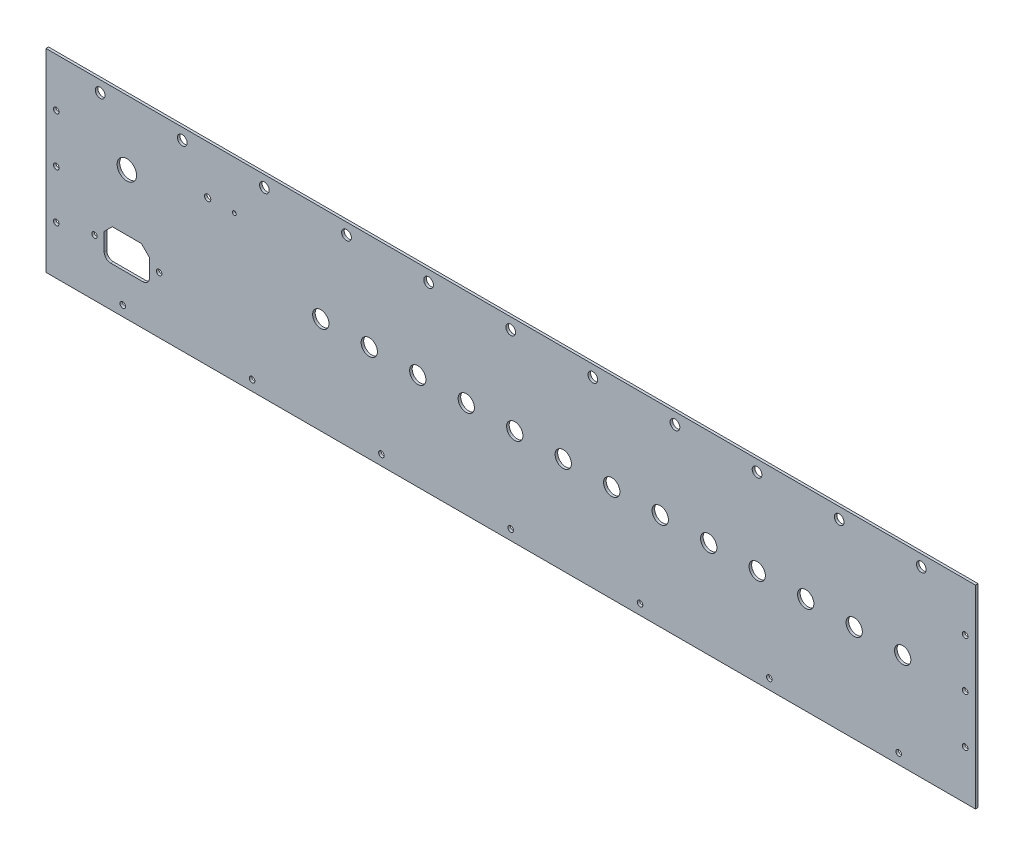
from build123d import *

# Parameters (mm, degrees)
SKETCH1_W               = 575
SKETCH1_H               = 120
BOSS_EXTRUDE1_DEPTH     = 1.5875
M3_CLEARANCE_HOLE1_D    = 3.4
F_3_8_CLEARANCE_HOLE1_D = 10.0838
LPATTERN1_COUNT         = 13
LPATTERN1_PITCH         = 30
CUT_EXTRUDE1_REACH      = 295.698
SKETCH8_R               = 1.95
SKETCH8_R_2             = 1.2
CUT_EXTRUDE2_REACH      = 295.698
SKETCH9_W               = 28
SKETCH9_H               = 20
FILLET1_R               = 4
CHAMFER1_SIZE           = 5
CUT_EXTRUDE3_REACH      = 295.698
SKETCH10_R              = 6
CUT_EXTRUDE4_REACH      = 295.698
SKETCH11_R              = 3
LPATTERN2_COUNT         = 11
LPATTERN2_PITCH         = 50.8
F_5_CLEARANCE_HOLE1_D   = 3.4544
F_5_CLEARANCE_HOLE2_D   = 3.4544
F_5_CLEARANCE_HOLE3_D   = 3.4544


with BuildPart() as part:
    # Sketch1 → Boss-Extrude1 (new body)
    with BuildSketch(Plane.XY):
        Rectangle(SKETCH1_W, SKETCH1_H)
    extrude(amount=BOSS_EXTRUDE1_DEPTH)

    # M3 Clearance Hole1 (through all)
    with Locations(Plane.XY.offset(1.5875)):
        with Locations((-257.5, -25), (-217.5, -25)):
            Hole(M3_CLEARANCE_HOLE1_D / 2)

    # 3/8 Clearance Hole1 (through all)
    with Locations(Plane.XY.offset(1.5875)):
        with Locations((-117.5, 0)):
            f_3_8_clearance_hole1 = Hole(F_3_8_CLEARANCE_HOLE1_D / 2)

    # LPattern1: 3/8 Clearance Hole1 ×13
    with Locations(*[(i * LPATTERN1_PITCH, 0, 0) for i in range(1, LPATTERN1_COUNT)]):
        add(f_3_8_clearance_hole1, mode=Mode.SUBTRACT)

    # Sketch8 → Cut-Extrude1 (cut, up to next)
    with BuildSketch(Plane.XY.offset(1.5875), mode=Mode.PRIVATE) as cut_extrude1_sk1:
        with Locations((-187.5, 30)):
            Circle(SKETCH8_R)
    cut_extrude1_tool1 = extrude(cut_extrude1_sk1.sketch, amount=-CUT_EXTRUDE1_REACH, mode=Mode.PRIVATE) & part.part
    # Sketch8 → Cut-Extrude1 (cut, up to next)
    with BuildSketch(Plane.XY.offset(1.5875), mode=Mode.PRIVATE) as cut_extrude1_sk2:
        with Locations((-170.99, 30)):
            Circle(SKETCH8_R_2)
    cut_extrude1_tool2 = extrude(cut_extrude1_sk2.sketch, amount=-CUT_EXTRUDE1_REACH, mode=Mode.PRIVATE) & part.part
    add(cut_extrude1_tool1.solids().sort_by_distance((-187.5, 30, 1.5875))[0], mode=Mode.SUBTRACT)
    add(cut_extrude1_tool2.solids().sort_by_distance((-170.99, 30, 1.5875))[0], mode=Mode.SUBTRACT)

    # Sketch9 → Cut-Extrude2 (cut, up to next)
    with BuildSketch(Plane.XY.offset(1.5875), mode=Mode.PRIVATE) as cut_extrude2_sk1:
        with Locations((-237.5, -25)):
            Rectangle(SKETCH9_W, SKETCH9_H)
    cut_extrude2_tool1 = extrude(cut_extrude2_sk1.sketch, amount=-CUT_EXTRUDE2_REACH, mode=Mode.PRIVATE) & part.part
    add(cut_extrude2_tool1.solids().sort_by_distance((-237.5, -25, 1.5875))[0], mode=Mode.SUBTRACT)

    # Fillet1
    fillet1_edges = [part.edges().sort_by_distance(p)[0] for p in [
        (-223.5, -35, 0.79375),
        (-251.5, -35, 0.79375),
    ]]
    fillet(fillet1_edges, radius=FILLET1_R)

    # Chamfer1
    chamfer1_edges = [part.edges().sort_by_distance(p)[0] for p in [
        (-223.5, -15, 0.79375),
        (-251.5, -15, 0.79375),
    ]]
    chamfer(chamfer1_edges, length=CHAMFER1_SIZE)

    # Sketch10 → Cut-Extrude3 (cut, up to next)
    with BuildSketch(Plane.XY.offset(1.5875), mode=Mode.PRIVATE) as cut_extrude3_sk1:
        with Locations((-237.5, 20)):
            Circle(SKETCH10_R)
    cut_extrude3_tool1 = extrude(cut_extrude3_sk1.sketch, amount=-CUT_EXTRUDE3_REACH, mode=Mode.PRIVATE) & part.part
    add(cut_extrude3_tool1.solids().sort_by_distance((-237.5, 20, 1.5875))[0], mode=Mode.SUBTRACT)

    # Sketch11 → Cut-Extrude4 (cut, up to next)
    with BuildSketch(Plane(origin=(0, 0, 0), x_dir=(-1, 0, 0), z_dir=(0, 0, -1)), mode=Mode.PRIVATE) as cut_extrude4_sk1:
        with Locations((-254, 53)):
            Circle(SKETCH11_R)
    cut_extrude4_tool1 = extrude(cut_extrude4_sk1.sketch, amount=-CUT_EXTRUDE4_REACH, mode=Mode.PRIVATE) & part.part
    cut_extrude4 = cut_extrude4_tool1.solids().sort_by_distance((254, 53, 0))[0]
    add(cut_extrude4, mode=Mode.SUBTRACT)

    # LPattern2: Cut-Extrude4 ×11
    with Locations(*[(-i * LPATTERN2_PITCH, 0, 0) for i in range(1, LPATTERN2_COUNT)]):
        add(cut_extrude4, mode=Mode.SUBTRACT)

    # #5 Clearance Hole1 (through all)
    with Locations(Plane(origin=(0, 0, 0), x_dir=(-1, 0, 0), z_dir=(0, 0, -1))):
        with Locations((-281.15, 30), (-281.15, 0), (-281.15, -30)):
            Hole(F_5_CLEARANCE_HOLE1_D / 2)

    # #5 Clearance Hole2 (through all)
    with Locations(Plane(origin=(0, 0, 0), x_dir=(-1, 0, 0), z_dir=(0, 0, -1))):
        with Locations((281.15, 30), (281.15, 0), (281.15, -30)):
            Hole(F_5_CLEARANCE_HOLE2_D / 2)

    # #5 Clearance Hole3 (through all)
    with Locations(Plane(origin=(0, 0, 0), x_dir=(-1, 0, 0), z_dir=(0, 0, -1))):
        with Locations((-240, -53.65), (-160, -53.65), (-80, -53.65), (0, -53.65), (80, -53.65), (160, -53.65), (240, -53.65)):
            Hole(F_5_CLEARANCE_HOLE3_D / 2)


solid = part.part
